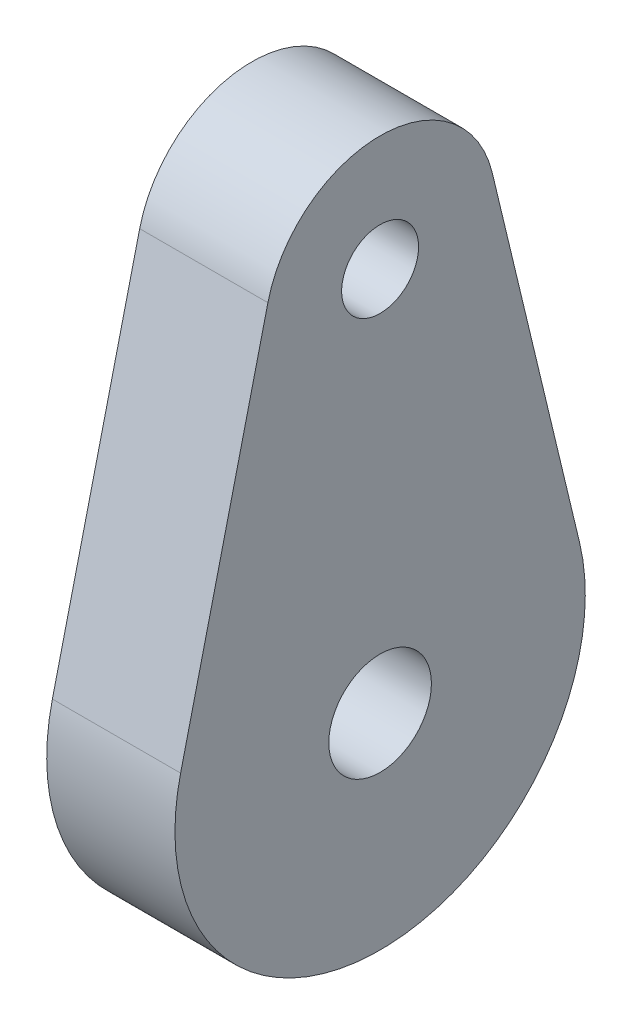
from build123d import *
from build123d.topology import SkipClean

# Parameters (mm, degrees)
SKETCH_1_R      = 2
SKETCH_1_R_2    = 1.5
EXTRUDE_1_DEPTH = 5
EXTRUDE_START   = 0.5
SKETCH_2_R      = 3
SKETCH_2_R_2    = 2
EXTRUDE_2_DEPTH = 0.5


with BuildPart() as part:
    # 草图1 → 凸台-拉伸1 (new body)
    with BuildSketch(Plane(origin=(0, 0, 0), x_dir=(0, 0, -1), z_dir=(1, 0, 0))):
        with BuildLine():
            Line((-7.779174478, 1.866666667), (-4.375785644, 16.05))
            ThreePointArc((-4.375785644, 16.05), (0, 19.5), (4.375785644, 16.05))
            Line((4.375785644, 16.05), (7.779174478, 1.866666667))
            ThreePointArc((7.779174478, 1.866666667), (0, -8), (-7.779174478, 1.866666667))
        make_face()
        Circle(SKETCH_1_R, mode=Mode.SUBTRACT)
        with Locations((0, 15)):
            Circle(SKETCH_1_R_2, mode=Mode.SUBTRACT)
    extrude(amount=EXTRUDE_1_DEPTH)

    # 草图2 → 凸台-拉伸2 (add)
    with SkipClean():  # the faces are left unmerged after this step: merging them gives an invalid solid
        with BuildSketch(Plane.ZY.offset(EXTRUDE_START)):
            Circle(SKETCH_2_R)
            Circle(SKETCH_2_R_2, mode=Mode.SUBTRACT)
        extrude(amount=-EXTRUDE_2_DEPTH)


solid = part.part
